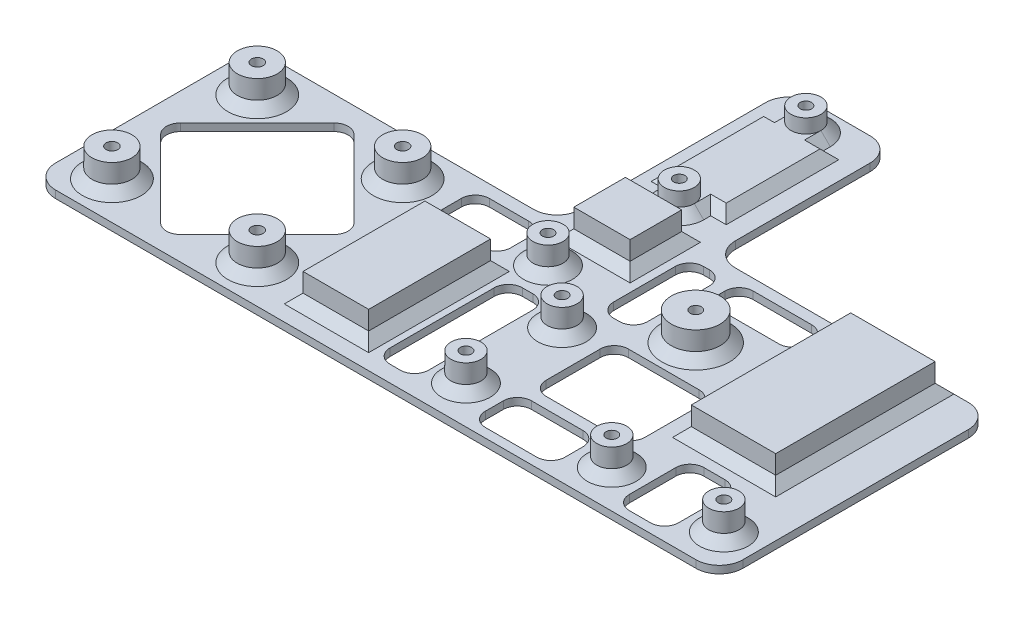
from build123d import *

# Parameters (mm, degrees)
SKETCH2_W            = 383.580116934
SKETCH2_H            = 394.749255115
BOSS_EXTRUDE1_DEPTH  = 10
SKETCH1_R            = 3.2
SKETCH1_R_2          = 1.2
BOSS_EXTRUDE2_DEPTH  = 6
SKETCH4_R            = 3.2
SKETCH4_R_2          = 1.2
BOSS_EXTRUDE3_DEPTH  = 6
SKETCH5_R            = 3.2
SKETCH5_R_2          = 1.2
BOSS_EXTRUDE4_DEPTH  = 6
SKETCH6_W            = 12
SKETCH6_H            = 20
BOSS_EXTRUDE5_DEPTH  = 2
SKETCH7_R            = 1.2
BOSS_EXTRUDE6_DEPTH  = 2
SKETCH8_R            = 3.2
SKETCH8_R_2          = 1.2
BOSS_EXTRUDE7_DEPTH  = 3
SKETCH9_R            = 5.2
SKETCH9_R_2          = 1.2
BOSS_EXTRUDE8_DEPTH  = 6
SKETCH10_R           = 4.25
SKETCH10_R_2         = 1.25
BOSS_EXTRUDE9_DEPTH  = 6
CHAMFER1_SIZE        = 2
SKETCH12_W           = 383.580116934
SKETCH12_H           = 394.749255115
CUT_EXTRUDE4_DEPTH   = 8.4
SKETCH14_W           = 18
SKETCH14_H           = 34
SKETCH14_W_2         = 14
SKETCH14_H_2         = 26
SKETCH14_W_3         = 12
SKETCH14_H_3         = 11
BOSS_EXTRUDE10_DEPTH = 6
CHAMFER2_SIZE        = 2
SKETCH15_W           = 383.580116934
SKETCH15_H           = 394.749255115
CUT_EXTRUDE5_DEPTH   = 311.030594177
FILLET1_R            = 5
SKETCH16_W           = 21.09180762
SKETCH16_H           = 17.522424792
SKETCH16_W_2         = 7.246928772
SKETCH16_H_2         = 19.144871533
SKETCH16_W_3         = 10.491822252
SKETCH16_H_3         = 15.899978052
SKETCH16_W_4         = 16.981609212
SKETCH16_H_4         = 9.842843556
SKETCH16_W_5         = 8.220396816
SKETCH16_H_5         = 28.234737601
SKETCH16_W_6         = 14.385694428
SKETCH16_H_6         = 9.842843557
SKETCH16_W_7         = 18.495892836
SKETCH16_H_7         = 7.03060254
CUT_EXTRUDE6_DEPTH   = 166.380706417
FILLET2_R            = 3


# Some blends are built 0.0001 mm under size
with BuildPart() as part:
    # Sketch2 → Boss-Extrude1 (new body)
    with BuildSketch(Plane(origin=(0, 0, 0), x_dir=(1, 0, 0), z_dir=(0, 1, 0))):
        with Locations((-36.469568214, 12.340684599)):
            Rectangle(SKETCH2_W, SKETCH2_H)
    extrude(amount=-BOSS_EXTRUDE1_DEPTH)

    # Sketch1 → Boss-Extrude2 (add)
    # profile 1 of 2: a face of its own
    with BuildSketch(Plane(origin=(0, 0, 0), x_dir=(1, 0, 0), z_dir=(0, 1, 0))):
        with Locations(Location((-23.9, 0, 0), (0, 0, 90))):
            Circle(SKETCH1_R)
        with Locations(Location((-23.9, 0, 0), (0, 0, 270))):
            Circle(SKETCH1_R_2, mode=Mode.SUBTRACT)
    # profile 2 of 2: a face of its own
    with BuildSketch(Plane(origin=(0, 0, 0), x_dir=(1, 0, 0), z_dir=(0, 1, 0))):
        with Locations(Location((0, 0, 0), (0, 0, 90))):
            Circle(SKETCH1_R)
        with Locations(Location((0, 0, 0), (0, 0, 270))):
            Circle(SKETCH1_R_2, mode=Mode.SUBTRACT)
    extrude(amount=BOSS_EXTRUDE2_DEPTH)

    # Sketch4 → Boss-Extrude3 (add)
    # profile 1 of 2: a face of its own
    with BuildSketch(Plane(origin=(0, 0, 0), x_dir=(1, 0, 0), z_dir=(0, 1, 0))):
        with Locations(Location((-55, 20.5, 0), (0, 0, 90))):
            Circle(SKETCH4_R)
        with Locations(Location((-55, 20.5, 0), (0, 0, 270))):
            Circle(SKETCH4_R_2, mode=Mode.SUBTRACT)
    # profile 2 of 2: a face of its own
    with BuildSketch(Plane(origin=(0, 0, 0), x_dir=(1, 0, 0), z_dir=(0, 1, 0))):
        with Locations(Location((-55, 0, 0), (0, 0, 90))):
            Circle(SKETCH4_R)
        with Locations(Location((-55, 0, 0), (0, 0, 270))):
            Circle(SKETCH4_R_2, mode=Mode.SUBTRACT)
    extrude(amount=BOSS_EXTRUDE3_DEPTH)

    # Sketch5 → Boss-Extrude4 (add)
    with BuildSketch(Plane(origin=(0, 0, 0), x_dir=(1, 0, 0), z_dir=(0, 1, 0))):
        with Locations(Location((-68, 30.5, 0), (0, 0, 90))):
            Circle(SKETCH5_R)
        with Locations(Location((-68, 30.5, 0), (0, 0, 270))):
            Circle(SKETCH5_R_2, mode=Mode.SUBTRACT)
    extrude(amount=BOSS_EXTRUDE4_DEPTH)

    # Sketch6 → Boss-Extrude5 (add)
    with BuildSketch(Plane(origin=(0, 0, 0), x_dir=(1, 0, 0), z_dir=(0, 1, 0))):
        with Locations((-64.5, 69)):
            Rectangle(SKETCH6_W, SKETCH6_H)
    extrude(amount=BOSS_EXTRUDE5_DEPTH)

    # Sketch7 → Boss-Extrude6 (add)
    # profile 1 of 2: a face of its own
    with BuildSketch(Plane(origin=(0, 0, 0), x_dir=(1, 0, 0), z_dir=(0, 1, 0))):
        with BuildLine():
            Line((-68.2, 55.5), (-68.2, 59))
            Line((-68.2, 59), (-61.8, 59))
            Line((-61.8, 59), (-61.8, 55.5))
            ThreePointArc((-61.8, 55.5), (-65, 52.3), (-68.2, 55.5))
        make_face()
        with Locations(Location((-65, 55.5, 0), (0, 0, 270))):
            Circle(SKETCH7_R, mode=Mode.SUBTRACT)
    # profile 2 of 2: a face of its own
    with BuildSketch(Plane(origin=(0, 0, 0), x_dir=(1, 0, 0), z_dir=(0, 1, 0))):
        with BuildLine():
            Line((-68.2, 79), (-68.2, 82.5))
            ThreePointArc((-68.2, 82.5), (-65, 85.7), (-61.8, 82.5))
            Line((-61.8, 82.5), (-61.8, 79))
            Line((-61.8, 79), (-68.2, 79))
        make_face()
        with Locations(Location((-65, 82.5, 0), (0, 0, 270))):
            Circle(SKETCH7_R, mode=Mode.SUBTRACT)
    extrude(amount=BOSS_EXTRUDE6_DEPTH)

    # Sketch8 → Boss-Extrude7 (add)
    # profile 1 of 2: a face of its own
    with BuildSketch(Plane(origin=(0, 2, 0), x_dir=(1, 0, 0), z_dir=(0, 1, 0))):
        with Locations((-65, 55.5)):
            Circle(SKETCH8_R)
        with Locations(Location((-65, 55.5, 0), (0, 0, 270))):
            Circle(SKETCH8_R_2, mode=Mode.SUBTRACT)
    # profile 2 of 2: a face of its own
    with BuildSketch(Plane(origin=(0, 2, 0), x_dir=(1, 0, 0), z_dir=(0, 1, 0))):
        with Locations(Location((-65, 82.5, 0), (0, 0, 180))):
            Circle(SKETCH8_R)
        with Locations(Location((-65, 82.5, 0), (0, 0, 270))):
            Circle(SKETCH8_R_2, mode=Mode.SUBTRACT)
    extrude(amount=BOSS_EXTRUDE7_DEPTH)

    # Sketch9 → Boss-Extrude8 (add)
    with BuildSketch(Plane(origin=(0, 0, 0), x_dir=(1, 0, 0), z_dir=(0, 1, 0))):
        with Locations(Location((-38, 32, 0), (0, 0, 90))):
            Circle(SKETCH9_R)
        with Locations(Location((-38, 32, 0), (0, 0, 270))):
            Circle(SKETCH9_R_2, mode=Mode.SUBTRACT)
    extrude(amount=BOSS_EXTRUDE8_DEPTH)

    # Sketch10 → Boss-Extrude9 (add)
    # profile 1 of 4: a face of its own
    with BuildSketch(Plane(origin=(0, 0, 0), x_dir=(1, 0, 0), z_dir=(0, 1, 0))):
        with Locations(Location((-130.5, 31, 0), (0, 0, 90))):
            Circle(SKETCH10_R)
        with Locations(Location((-130.5, 31, 0), (0, 0, 270))):
            Circle(SKETCH10_R_2, mode=Mode.SUBTRACT)
    # profile 2 of 4: a face of its own
    with BuildSketch(Plane(origin=(0, 0, 0), x_dir=(1, 0, 0), z_dir=(0, 1, 0))):
        with Locations(Location((-99.5, 31, 0), (0, 0, 90))):
            Circle(SKETCH10_R)
        with Locations(Location((-99.5, 31, 0), (0, 0, 270))):
            Circle(SKETCH10_R_2, mode=Mode.SUBTRACT)
    # profile 3 of 4: a face of its own
    with BuildSketch(Plane(origin=(0, 0, 0), x_dir=(1, 0, 0), z_dir=(0, 1, 0))):
        with Locations(Location((-99.5, 0, 0), (0, 0, 90))):
            Circle(SKETCH10_R)
        with Locations(Location((-99.5, 0, 0), (0, 0, 270))):
            Circle(SKETCH10_R_2, mode=Mode.SUBTRACT)
    # profile 4 of 4: a face of its own
    with BuildSketch(Plane(origin=(0, 0, 0), x_dir=(1, 0, 0), z_dir=(0, 1, 0))):
        with Locations(Location((-130.5, 0, 0), (0, 0, 90))):
            Circle(SKETCH10_R)
        with Locations(Location((-130.5, 0, 0), (0, 0, 270))):
            Circle(SKETCH10_R_2, mode=Mode.SUBTRACT)
    extrude(amount=BOSS_EXTRUDE9_DEPTH)

    # Chamfer1
    chamfer1_edges = [part.edges().sort_by_distance(p)[0] for p in [
        (0, 0, 3.2),
        (-23.9, 0, 3.2),
        (-55, 0, -17.3),
        (-55, 0, 3.2),
        (-68, 0, -27.3),
        (-99.5, 0, -26.75),
        (-130.5, 0, -26.75),
        (-68.2, 0, -80.75),
        (-65, 0, -85.7),
        (-61.8, 0, -80.75),
        (-60.15, 0, -79),
        (-58.5, 0, -69),
        (-60.15, 0, -59),
        (-61.8, 0, -57.25),
        (-69.35, 0, -79),
        (-70.5, 0, -69),
        (-69.35, 0, -59),
        (-68.2, 0, -57.25),
        (-65, 0, -52.3),
        (-130.5, 0, 4.25),
        (-99.5, 0, 4.25),
        (-38, 0, -26.8),
    ]]
    chamfer(chamfer1_edges, length=CHAMFER1_SIZE - 0.0001)  # a hair under: the kernel refuses the full size

    # Sketch12 → Cut-Extrude4 (cut)
    with BuildSketch(Plane.XZ.offset(10)):
        with Locations((-36.469568214, -12.340684599)):
            Rectangle(SKETCH12_W, SKETCH12_H)
    extrude(amount=-CUT_EXTRUDE4_DEPTH, mode=Mode.SUBTRACT)

    # Sketch14 → Boss-Extrude10 (add)
    with BuildSketch(Plane(origin=(0, 0, 0), x_dir=(1, 0, 0), z_dir=(0, 1, 0))):
        with Locations((-11.95, 31)):
            Rectangle(SKETCH14_W, SKETCH14_H)
        with Locations((-80, 10.25)):
            Rectangle(SKETCH14_W_2, SKETCH14_H_2)
        with Locations((-64, 43.5)):
            Rectangle(SKETCH14_W_3, SKETCH14_H_3)
    extrude(amount=BOSS_EXTRUDE10_DEPTH)

    # Chamfer2
    # the kernel refuses this chamfer: 2 mm, written as the material it adds along each edge
    with BuildSketch(Plane(origin=(-20.95, 0, -14), x_dir=(-0.9996219169112968, -0.02749587661058639, 0), z_dir=(0, 0, -1)), Plane(origin=(-2.95, 0, -48), x_dir=(0.9996219169112968, -0.027495876610586435, 0), z_dir=(0, 0, 1))) as chamfer2_piece_1:
        Polygon((CHAMFER2_SIZE * 0.999621916911, CHAMFER2_SIZE * 0.0274958766106), (-CHAMFER2_SIZE * 0.0274958766106, CHAMFER2_SIZE * 0.999621916911), (0, 0), align=None)
    extrude(amount=34)
    with BuildSketch(Plane(origin=(-2.95, 0, -14), x_dir=(0, -0.027495876610586365, 0.9996219169112968), z_dir=(-1, 0, 0)), Plane(origin=(-20.95, 0, -48), x_dir=(0, -0.02749587661058639, -0.9996219169112968), z_dir=(1, 0, 0))) as chamfer2_piece_2:
        Polygon((CHAMFER2_SIZE * 0.999621916911, CHAMFER2_SIZE * 0.0274958766106), (-CHAMFER2_SIZE * 0.0274958766106, CHAMFER2_SIZE * 0.999621916911), (0, 0), align=None)
    extrude(amount=18)
    with BuildSketch(Plane(origin=(-73, 0, 2.75), x_dir=(0.9996219169112968, -0.027495876610586292, 0), z_dir=(0, 0, -1)), Plane(origin=(-87, 0, -23.25), x_dir=(-0.9996219169112968, -0.027495876610586292, 0), z_dir=(0, 0, 1))) as chamfer2_piece_3:
        Polygon((CHAMFER2_SIZE * 0.999621916911, -CHAMFER2_SIZE * 0.0274958766106), (-CHAMFER2_SIZE * 0.0274958766106, -CHAMFER2_SIZE * 0.999621916911), (0, 0), align=None)
    extrude(amount=26)
    with BuildSketch(Plane(origin=(-73, 0, -23.25), x_dir=(-1.0146772736684403e-15, -0.02749587661058639, -0.9996219169112968), z_dir=(-1, 0, 0)), Plane(origin=(-87, 0, 2.75), x_dir=(0, -0.027495876610586334, 0.9996219169112968), z_dir=(1, 0, 0))) as chamfer2_piece_4:
        Polygon((CHAMFER2_SIZE * 0.999621916911, -CHAMFER2_SIZE * 0.0274958766106), (-CHAMFER2_SIZE * 0.0274958766106, -CHAMFER2_SIZE * 0.999621916911), (0, 0), align=None)
    extrude(amount=14)
    with BuildSketch(Plane(origin=(-70, 0, -49), x_dir=(-0.9996219169112968, -0.027495876610586292, 0), z_dir=(0, 0, 1)), Plane(origin=(-58, 0, -38), x_dir=(0.9996219169112968, -0.02749587661058639, 0), z_dir=(0, 0, -1))) as chamfer2_piece_5:
        Polygon((CHAMFER2_SIZE * 0.999621916911, -CHAMFER2_SIZE * 0.0274958766106), (-CHAMFER2_SIZE * 0.0274958766106, -CHAMFER2_SIZE * 0.999621916911), (0, 0), align=None)
    extrude(amount=11)
    with BuildSketch(Plane(origin=(-70, 0, -38), x_dir=(0, -0.02749587661058639, 0.9996219169112968), z_dir=(1, 0, 0)), Plane(origin=(-58, 0, -49), x_dir=(0, -0.02749587661058639, -0.9996219169112968), z_dir=(-1, 0, 0))) as chamfer2_piece_6:
        Polygon((CHAMFER2_SIZE * 0.999621916911, -CHAMFER2_SIZE * 0.0274958766106), (-CHAMFER2_SIZE * 0.0274958766106, -CHAMFER2_SIZE * 0.999621916911), (0, 0), align=None)
    extrude(amount=12)
    with BuildSketch(Plane(origin=(-20.95, 0, -8.856634024), x_dir=(-0.9996219169112968, -0.02749587661058639, 0), z_dir=(0, 0, -1))) as chamfer2_piece_7a_section:
        Polygon((CHAMFER2_SIZE * 0.999621916911, CHAMFER2_SIZE * 0.0274958766106), (-CHAMFER2_SIZE * 0.0274958766106, CHAMFER2_SIZE * 0.999621916911), (0, 0), align=None)
    chamfer2_piece_7a = extrude(amount=39.143365976, mode=Mode.PRIVATE)
    chamfer2_piece_7a = split(chamfer2_piece_7a, bisect_by=Plane(origin=(-21.609587254, 0.659587254, -14), z_dir=(0, 0, 1)), keep=Keep.TOP, mode=Mode.PRIVATE)
    with BuildSketch(Plane(origin=(-2.95, 0, -14), x_dir=(0, -0.027495876610586365, 0.9996219169112968), z_dir=(-1, 0, 0))) as chamfer2_piece_7b_section:
        Polygon((CHAMFER2_SIZE * 0.999621916911, CHAMFER2_SIZE * 0.0274958766106), (-CHAMFER2_SIZE * 0.0274958766106, CHAMFER2_SIZE * 0.999621916911), (0, 0), align=None)
    chamfer2_piece_7b = extrude(amount=23.143365976, mode=Mode.PRIVATE)
    chamfer2_piece_7b = split(chamfer2_piece_7b, bisect_by=Plane(origin=(-20.95, 0.659587254, -13.340412746), z_dir=(-1, 0, 0)), keep=Keep.TOP, mode=Mode.PRIVATE)
    chamfer2_piece_7 = chamfer2_piece_7a & chamfer2_piece_7b
    add(chamfer2_piece_7)
    with BuildSketch(Plane(origin=(-20.95, 0, -14), x_dir=(-0.9996219169112968, -0.02749587661058639, 0), z_dir=(0, 0, -1))) as chamfer2_piece_8a_section:
        Polygon((CHAMFER2_SIZE * 0.999621916911, CHAMFER2_SIZE * 0.0274958766106), (-CHAMFER2_SIZE * 0.0274958766106, CHAMFER2_SIZE * 0.999621916911), (0, 0), align=None)
    chamfer2_piece_8a = extrude(amount=39.143365976, mode=Mode.PRIVATE)
    chamfer2_piece_8a = split(chamfer2_piece_8a, bisect_by=Plane(origin=(-21.609587254, 0.659587254, -48), z_dir=(0, 0, -1)), keep=Keep.TOP, mode=Mode.PRIVATE)
    with BuildSketch(Plane(origin=(-26.093365976, 0, -48), x_dir=(0, -0.02749587661058639, -0.9996219169112968), z_dir=(1, 0, 0))) as chamfer2_piece_8b_section:
        Polygon((CHAMFER2_SIZE * 0.999621916911, CHAMFER2_SIZE * 0.0274958766106), (-CHAMFER2_SIZE * 0.0274958766106, CHAMFER2_SIZE * 0.999621916911), (0, 0), align=None)
    chamfer2_piece_8b = extrude(amount=23.143365976, mode=Mode.PRIVATE)
    chamfer2_piece_8b = split(chamfer2_piece_8b, bisect_by=Plane(origin=(-20.95, 0.659587254, -48.659587254), z_dir=(-1, 0, 0)), keep=Keep.TOP, mode=Mode.PRIVATE)
    chamfer2_piece_8 = chamfer2_piece_8a & chamfer2_piece_8b
    add(chamfer2_piece_8)
    with BuildSketch(Plane(origin=(2.193365976, 0, -14), x_dir=(0, -0.027495876610586365, 0.9996219169112968), z_dir=(-1, 0, 0))) as chamfer2_piece_9a_section:
        Polygon((CHAMFER2_SIZE * 0.999621916911, CHAMFER2_SIZE * 0.0274958766106), (-CHAMFER2_SIZE * 0.0274958766106, CHAMFER2_SIZE * 0.999621916911), (0, 0), align=None)
    chamfer2_piece_9a = extrude(amount=23.143365976, mode=Mode.PRIVATE)
    chamfer2_piece_9a = split(chamfer2_piece_9a, bisect_by=Plane(origin=(-2.95, 0.659587254, -13.340412746), z_dir=(1, 0, 0)), keep=Keep.TOP, mode=Mode.PRIVATE)
    with BuildSketch(Plane(origin=(-2.95, 0, -48), x_dir=(0.9996219169112968, -0.027495876610586435, 0), z_dir=(0, 0, 1))) as chamfer2_piece_9b_section:
        Polygon((CHAMFER2_SIZE * 0.999621916911, CHAMFER2_SIZE * 0.0274958766106), (-CHAMFER2_SIZE * 0.0274958766106, CHAMFER2_SIZE * 0.999621916911), (0, 0), align=None)
    chamfer2_piece_9b = extrude(amount=39.143365976, mode=Mode.PRIVATE)
    chamfer2_piece_9b = split(chamfer2_piece_9b, bisect_by=Plane(origin=(-2.290412746, 0.659587254, -14), z_dir=(0, 0, 1)), keep=Keep.TOP, mode=Mode.PRIVATE)
    chamfer2_piece_9 = chamfer2_piece_9a & chamfer2_piece_9b
    add(chamfer2_piece_9)
    with BuildSketch(Plane(origin=(-2.95, 0, -53.143365976), x_dir=(0.9996219169112968, -0.02749587661058639, 0), z_dir=(0, 0, 1))) as chamfer2_piece_10a_section:
        Polygon((CHAMFER2_SIZE * 0.999621916911, CHAMFER2_SIZE * 0.0274958766106), (-CHAMFER2_SIZE * 0.0274958766106, CHAMFER2_SIZE * 0.999621916911), (0, 0), align=None)
    chamfer2_piece_10a = extrude(amount=39.143365976, mode=Mode.PRIVATE)
    chamfer2_piece_10a = split(chamfer2_piece_10a, bisect_by=Plane(origin=(-2.290412746, 0.659587254, -48), z_dir=(0, 0, -1)), keep=Keep.TOP, mode=Mode.PRIVATE)
    with BuildSketch(Plane(origin=(-20.95, 0, -48), x_dir=(0, -0.02749587661058639, -0.9996219169112968), z_dir=(1, 0, 0))) as chamfer2_piece_10b_section:
        Polygon((CHAMFER2_SIZE * 0.999621916911, CHAMFER2_SIZE * 0.0274958766106), (-CHAMFER2_SIZE * 0.0274958766106, CHAMFER2_SIZE * 0.999621916911), (0, 0), align=None)
    chamfer2_piece_10b = extrude(amount=23.143365976, mode=Mode.PRIVATE)
    chamfer2_piece_10b = split(chamfer2_piece_10b, bisect_by=Plane(origin=(-2.95, 0.659587254, -48.659587254), z_dir=(1, 0, 0)), keep=Keep.TOP, mode=Mode.PRIVATE)
    chamfer2_piece_10 = chamfer2_piece_10a & chamfer2_piece_10b
    add(chamfer2_piece_10)
    with BuildSketch(Plane(origin=(-87, 0, 2.75), x_dir=(0, -0.027495876610586334, 0.9996219169112968), z_dir=(1, 0, 0))) as chamfer2_piece_11a_section:
        Polygon((CHAMFER2_SIZE * 0.999621916911, -CHAMFER2_SIZE * 0.0274958766106), (-CHAMFER2_SIZE * 0.0274958766106, -CHAMFER2_SIZE * 0.999621916911), (0, 0), align=None)
    chamfer2_piece_11a = extrude(amount=19.143365976, mode=Mode.PRIVATE)
    chamfer2_piece_11a = split(chamfer2_piece_11a, bisect_by=Plane(origin=(-73, 0.659587254, 3.409587254), z_dir=(1, 0, 0)), keep=Keep.TOP, mode=Mode.PRIVATE)
    with BuildSketch(Plane(origin=(-73, 0, 7.893365976), x_dir=(0.9996219169112968, -0.027495876610586292, 0), z_dir=(0, 0, -1))) as chamfer2_piece_11b_section:
        Polygon((CHAMFER2_SIZE * 0.999621916911, -CHAMFER2_SIZE * 0.0274958766106), (-CHAMFER2_SIZE * 0.0274958766106, -CHAMFER2_SIZE * 0.999621916911), (0, 0), align=None)
    chamfer2_piece_11b = extrude(amount=31.143365976, mode=Mode.PRIVATE)
    chamfer2_piece_11b = split(chamfer2_piece_11b, bisect_by=Plane(origin=(-72.340412746, 0.659587254, 2.75), z_dir=(0, 0, 1)), keep=Keep.TOP, mode=Mode.PRIVATE)
    chamfer2_piece_11 = chamfer2_piece_11a & chamfer2_piece_11b
    add(chamfer2_piece_11)
    with BuildSketch(Plane(origin=(-67.856634024, 0, -23.25), x_dir=(-1.0146772736684403e-15, -0.02749587661058639, -0.9996219169112968), z_dir=(-1, 0, 0))) as chamfer2_piece_12a_section:
        Polygon((CHAMFER2_SIZE * 0.999621916911, -CHAMFER2_SIZE * 0.0274958766106), (-CHAMFER2_SIZE * 0.0274958766106, -CHAMFER2_SIZE * 0.999621916911), (0, 0), align=None)
    chamfer2_piece_12a = extrude(amount=19.143365976, mode=Mode.PRIVATE)
    chamfer2_piece_12a = split(chamfer2_piece_12a, bisect_by=Plane(origin=(-73, 0.659587254, -23.909587254), z_dir=(1, 0, 0)), keep=Keep.TOP, mode=Mode.PRIVATE)
    with BuildSketch(Plane(origin=(-73, 0, 2.75), x_dir=(0.9996219169112968, -0.027495876610586292, 0), z_dir=(0, 0, -1))) as chamfer2_piece_12b_section:
        Polygon((CHAMFER2_SIZE * 0.999621916911, -CHAMFER2_SIZE * 0.0274958766106), (-CHAMFER2_SIZE * 0.0274958766106, -CHAMFER2_SIZE * 0.999621916911), (0, 0), align=None)
    chamfer2_piece_12b = extrude(amount=31.143365976, mode=Mode.PRIVATE)
    chamfer2_piece_12b = split(chamfer2_piece_12b, bisect_by=Plane(origin=(-72.340412746, 0.659587254, -23.25), z_dir=(0, 0, -1)), keep=Keep.TOP, mode=Mode.PRIVATE)
    chamfer2_piece_12 = chamfer2_piece_12a & chamfer2_piece_12b
    add(chamfer2_piece_12)
    with BuildSketch(Plane(origin=(-73, 0, -23.25), x_dir=(-1.0146772736684403e-15, -0.02749587661058639, -0.9996219169112968), z_dir=(-1, 0, 0))) as chamfer2_piece_13a_section:
        Polygon((CHAMFER2_SIZE * 0.999621916911, -CHAMFER2_SIZE * 0.0274958766106), (-CHAMFER2_SIZE * 0.0274958766106, -CHAMFER2_SIZE * 0.999621916911), (0, 0), align=None)
    chamfer2_piece_13a = extrude(amount=19.143365976, mode=Mode.PRIVATE)
    chamfer2_piece_13a = split(chamfer2_piece_13a, bisect_by=Plane(origin=(-87, 0.659587254, -23.909587254), z_dir=(-1, 0, 0)), keep=Keep.TOP, mode=Mode.PRIVATE)
    with BuildSketch(Plane(origin=(-87, 0, -28.393365976), x_dir=(-0.9996219169112968, -0.027495876610586292, 0), z_dir=(0, 0, 1))) as chamfer2_piece_13b_section:
        Polygon((CHAMFER2_SIZE * 0.999621916911, -CHAMFER2_SIZE * 0.0274958766106), (-CHAMFER2_SIZE * 0.0274958766106, -CHAMFER2_SIZE * 0.999621916911), (0, 0), align=None)
    chamfer2_piece_13b = extrude(amount=31.143365976, mode=Mode.PRIVATE)
    chamfer2_piece_13b = split(chamfer2_piece_13b, bisect_by=Plane(origin=(-87.659587254, 0.659587254, -23.25), z_dir=(0, 0, -1)), keep=Keep.TOP, mode=Mode.PRIVATE)
    chamfer2_piece_13 = chamfer2_piece_13a & chamfer2_piece_13b
    add(chamfer2_piece_13)
    with BuildSketch(Plane(origin=(-87, 0, -23.25), x_dir=(-0.9996219169112968, -0.027495876610586292, 0), z_dir=(0, 0, 1))) as chamfer2_piece_14a_section:
        Polygon((CHAMFER2_SIZE * 0.999621916911, -CHAMFER2_SIZE * 0.0274958766106), (-CHAMFER2_SIZE * 0.0274958766106, -CHAMFER2_SIZE * 0.999621916911), (0, 0), align=None)
    chamfer2_piece_14a = extrude(amount=31.143365976, mode=Mode.PRIVATE)
    chamfer2_piece_14a = split(chamfer2_piece_14a, bisect_by=Plane(origin=(-87.659587254, 0.659587254, 2.75), z_dir=(0, 0, 1)), keep=Keep.TOP, mode=Mode.PRIVATE)
    with BuildSketch(Plane(origin=(-92.143365976, 0, 2.75), x_dir=(0, -0.027495876610586334, 0.9996219169112968), z_dir=(1, 0, 0))) as chamfer2_piece_14b_section:
        Polygon((CHAMFER2_SIZE * 0.999621916911, -CHAMFER2_SIZE * 0.0274958766106), (-CHAMFER2_SIZE * 0.0274958766106, -CHAMFER2_SIZE * 0.999621916911), (0, 0), align=None)
    chamfer2_piece_14b = extrude(amount=19.143365976, mode=Mode.PRIVATE)
    chamfer2_piece_14b = split(chamfer2_piece_14b, bisect_by=Plane(origin=(-87, 0.659587254, 3.409587254), z_dir=(-1, 0, 0)), keep=Keep.TOP, mode=Mode.PRIVATE)
    chamfer2_piece_14 = chamfer2_piece_14a & chamfer2_piece_14b
    add(chamfer2_piece_14)
    with BuildSketch(Plane(origin=(-58, 0, -49), x_dir=(0, -0.02749587661058639, -0.9996219169112968), z_dir=(-1, 0, 0))) as chamfer2_piece_15a_section:
        Polygon((CHAMFER2_SIZE * 0.999621916911, -CHAMFER2_SIZE * 0.0274958766106), (-CHAMFER2_SIZE * 0.0274958766106, -CHAMFER2_SIZE * 0.999621916911), (0, 0), align=None)
    chamfer2_piece_15a = extrude(amount=17.143365976, mode=Mode.PRIVATE)
    chamfer2_piece_15a = split(chamfer2_piece_15a, bisect_by=Plane(origin=(-70, 0.659587254, -49.659587254), z_dir=(-1, 0, 0)), keep=Keep.TOP, mode=Mode.PRIVATE)
    with BuildSketch(Plane(origin=(-70, 0, -54.143365976), x_dir=(-0.9996219169112968, -0.027495876610586292, 0), z_dir=(0, 0, 1))) as chamfer2_piece_15b_section:
        Polygon((CHAMFER2_SIZE * 0.999621916911, -CHAMFER2_SIZE * 0.0274958766106), (-CHAMFER2_SIZE * 0.0274958766106, -CHAMFER2_SIZE * 0.999621916911), (0, 0), align=None)
    chamfer2_piece_15b = extrude(amount=16.143365976, mode=Mode.PRIVATE)
    chamfer2_piece_15b = split(chamfer2_piece_15b, bisect_by=Plane(origin=(-70.659587254, 0.659587254, -49), z_dir=(0, 0, -1)), keep=Keep.TOP, mode=Mode.PRIVATE)
    chamfer2_piece_15 = chamfer2_piece_15a & chamfer2_piece_15b
    add(chamfer2_piece_15)
    with BuildSketch(Plane(origin=(-75.143365976, 0, -38), x_dir=(0, -0.02749587661058639, 0.9996219169112968), z_dir=(1, 0, 0))) as chamfer2_piece_16a_section:
        Polygon((CHAMFER2_SIZE * 0.999621916911, -CHAMFER2_SIZE * 0.0274958766106), (-CHAMFER2_SIZE * 0.0274958766106, -CHAMFER2_SIZE * 0.999621916911), (0, 0), align=None)
    chamfer2_piece_16a = extrude(amount=17.143365976, mode=Mode.PRIVATE)
    chamfer2_piece_16a = split(chamfer2_piece_16a, bisect_by=Plane(origin=(-70, 0.659587254, -37.340412746), z_dir=(-1, 0, 0)), keep=Keep.TOP, mode=Mode.PRIVATE)
    with BuildSketch(Plane(origin=(-70, 0, -49), x_dir=(-0.9996219169112968, -0.027495876610586292, 0), z_dir=(0, 0, 1))) as chamfer2_piece_16b_section:
        Polygon((CHAMFER2_SIZE * 0.999621916911, -CHAMFER2_SIZE * 0.0274958766106), (-CHAMFER2_SIZE * 0.0274958766106, -CHAMFER2_SIZE * 0.999621916911), (0, 0), align=None)
    chamfer2_piece_16b = extrude(amount=16.143365976, mode=Mode.PRIVATE)
    chamfer2_piece_16b = split(chamfer2_piece_16b, bisect_by=Plane(origin=(-70.659587254, 0.659587254, -38), z_dir=(0, 0, 1)), keep=Keep.TOP, mode=Mode.PRIVATE)
    chamfer2_piece_16 = chamfer2_piece_16a & chamfer2_piece_16b
    add(chamfer2_piece_16)
    with BuildSketch(Plane(origin=(-70, 0, -38), x_dir=(0, -0.02749587661058639, 0.9996219169112968), z_dir=(1, 0, 0))) as chamfer2_piece_17a_section:
        Polygon((CHAMFER2_SIZE * 0.999621916911, -CHAMFER2_SIZE * 0.0274958766106), (-CHAMFER2_SIZE * 0.0274958766106, -CHAMFER2_SIZE * 0.999621916911), (0, 0), align=None)
    chamfer2_piece_17a = extrude(amount=17.143365976, mode=Mode.PRIVATE)
    chamfer2_piece_17a = split(chamfer2_piece_17a, bisect_by=Plane(origin=(-58, 0.659587254, -37.340412746), z_dir=(1, 0, 0)), keep=Keep.TOP, mode=Mode.PRIVATE)
    with BuildSketch(Plane(origin=(-58, 0, -32.856634024), x_dir=(0.9996219169112968, -0.02749587661058639, 0), z_dir=(0, 0, -1))) as chamfer2_piece_17b_section:
        Polygon((CHAMFER2_SIZE * 0.999621916911, -CHAMFER2_SIZE * 0.0274958766106), (-CHAMFER2_SIZE * 0.0274958766106, -CHAMFER2_SIZE * 0.999621916911), (0, 0), align=None)
    chamfer2_piece_17b = extrude(amount=16.143365976, mode=Mode.PRIVATE)
    chamfer2_piece_17b = split(chamfer2_piece_17b, bisect_by=Plane(origin=(-57.340412746, 0.659587254, -38), z_dir=(0, 0, 1)), keep=Keep.TOP, mode=Mode.PRIVATE)
    chamfer2_piece_17 = chamfer2_piece_17a & chamfer2_piece_17b
    add(chamfer2_piece_17)
    with BuildSketch(Plane(origin=(-58, 0, -38), x_dir=(0.9996219169112968, -0.02749587661058639, 0), z_dir=(0, 0, -1))) as chamfer2_piece_18a_section:
        Polygon((CHAMFER2_SIZE * 0.999621916911, -CHAMFER2_SIZE * 0.0274958766106), (-CHAMFER2_SIZE * 0.0274958766106, -CHAMFER2_SIZE * 0.999621916911), (0, 0), align=None)
    chamfer2_piece_18a = extrude(amount=16.143365976, mode=Mode.PRIVATE)
    chamfer2_piece_18a = split(chamfer2_piece_18a, bisect_by=Plane(origin=(-57.340412746, 0.659587254, -49), z_dir=(0, 0, -1)), keep=Keep.TOP, mode=Mode.PRIVATE)
    with BuildSketch(Plane(origin=(-52.856634024, 0, -49), x_dir=(0, -0.02749587661058639, -0.9996219169112968), z_dir=(-1, 0, 0))) as chamfer2_piece_18b_section:
        Polygon((CHAMFER2_SIZE * 0.999621916911, -CHAMFER2_SIZE * 0.0274958766106), (-CHAMFER2_SIZE * 0.0274958766106, -CHAMFER2_SIZE * 0.999621916911), (0, 0), align=None)
    chamfer2_piece_18b = extrude(amount=17.143365976, mode=Mode.PRIVATE)
    chamfer2_piece_18b = split(chamfer2_piece_18b, bisect_by=Plane(origin=(-58, 0.659587254, -49.659587254), z_dir=(1, 0, 0)), keep=Keep.TOP, mode=Mode.PRIVATE)
    chamfer2_piece_18 = chamfer2_piece_18a & chamfer2_piece_18b
    add(chamfer2_piece_18)

    # Sketch15 → Cut-Extrude5 (cut, through all)
    with BuildSketch(Plane(origin=(0, 0, 0), x_dir=(1, 0, 0), z_dir=(0, 1, 0))):
        with Locations((-36.469568214, 12.340684599)):
            Rectangle(SKETCH15_W, SKETCH15_H)
        Polygon((7.136342051, -8.087032279), (7.136342051, 50), (-52.55556973, 50), (-52.55556973, 88.764598805), (-74.860683051, 88.764598805), (-74.860683051, 39.299061969), (-139.411707019, 39.299061969), (-139.411707019, -8.087032279), align=None, mode=Mode.SUBTRACT)
    extrude(amount=-CUT_EXTRUDE5_DEPTH, mode=Mode.SUBTRACT)

    # Fillet1
    fillet1_edges = [part.edges().sort_by_distance(p)[0] for p in [
        (-139.411707019, -0.8, 8.087032279),
        (-139.411707019, -0.8, -39.299061969),
        (-74.860683051, -0.8, -39.299061969),
        (-74.860683051, -0.8, -88.764598805),
        (-52.55556973, -0.8, -88.764598805),
        (-52.55556973, -0.8, -50),
        (7.136342051, -0.8, -50),
        (7.136342051, -0.8, 8.087032279),
    ]]
    fillet(fillet1_edges, radius=FILLET1_R)

    # Sketch16 → Cut-Extrude6 (cut, through all)
    with BuildSketch(Plane(origin=(0, 0, 0), x_dir=(1, 0, 0), z_dir=(0, 1, 0))):
        Polygon((-115, 36.107155761), (-135.607155761, 15.5), (-115, -5.107155761), (-94.392844239, 15.5), align=None)
        with Locations((-36.446907142, 14.866369444)):
            Rectangle(SKETCH16_W, SKETCH16_H)
        with Locations((-50.616275338, 37.310216014)):
            Rectangle(SKETCH16_W_2, SKETCH16_H_2)
        with Locations((-11.785716693, 1.832713966)):
            Rectangle(SKETCH16_W_3, SKETCH16_H_3)
        with Locations((-39.259148158, -1.195853282)):
            Rectangle(SKETCH16_W_4, SKETCH16_H_4)
        with Locations((-65.488703788, 9.510213039)):
            Rectangle(SKETCH16_W_5, SKETCH16_H_5)
        with Locations((-82.416231442, 31.685733983)):
            Rectangle(SKETCH16_W_6, SKETCH16_H_6)
        with Locations((-35.14894975, 44.124492323)):
            Rectangle(SKETCH16_W_7, SKETCH16_H_7)
    extrude(amount=-CUT_EXTRUDE6_DEPTH, mode=Mode.SUBTRACT)

    # Fillet2
    fillet2_edges = [part.edges().sort_by_distance(p)[0] for p in [
        (-30.768343552, -0.8, -3.725568496),
        (-30.768343552, -0.8, 6.11727506),
        (-47.749952764, -0.8, 6.11727506),
        (-47.749952764, -0.8, -3.725568496),
        (-46.992810952, -0.8, -46.882651781),
        (-46.992810952, -0.8, -27.737780248),
        (-54.239739724, -0.8, -27.737780248),
        (-54.239739724, -0.8, -46.882651781),
        (-17.031627819, -0.8, 6.11727506),
        (-17.031627819, -0.8, -9.782702992),
        (-6.539805567, -0.8, -9.782702992),
        (-6.539805567, -0.8, 6.11727506),
        (-115, -0.8, -36.107155761),
        (-94.392844239, -0.8, -15.5),
        (-115, -0.8, 5.107155761),
        (-135.607155761, -0.8, -15.5),
        (-61.37850538, -0.8, -23.62758184),
        (-61.37850538, -0.8, 4.607155761),
        (-69.598902196, -0.8, 4.607155761),
        (-69.598902196, -0.8, -23.62758184),
        (-75.223384228, -0.8, -36.607155761),
        (-75.223384228, -0.8, -26.764312204),
        (-89.609078656, -0.8, -26.764312204),
        (-89.609078656, -0.8, -36.607155761),
        (-44.396896168, -0.8, -40.609191053),
        (-44.396896168, -0.8, -47.639793593),
        (-25.901003332, -0.8, -47.639793593),
        (-25.901003332, -0.8, -40.609191053),
        (-25.901003332, -0.8, -23.62758184),
        (-25.901003332, -0.8, -6.105157048),
        (-46.992810952, -0.8, -6.105157048),
        (-46.992810952, -0.8, -23.62758184),
    ]]
    fillet(fillet2_edges, radius=FILLET2_R)


solid = part.part
